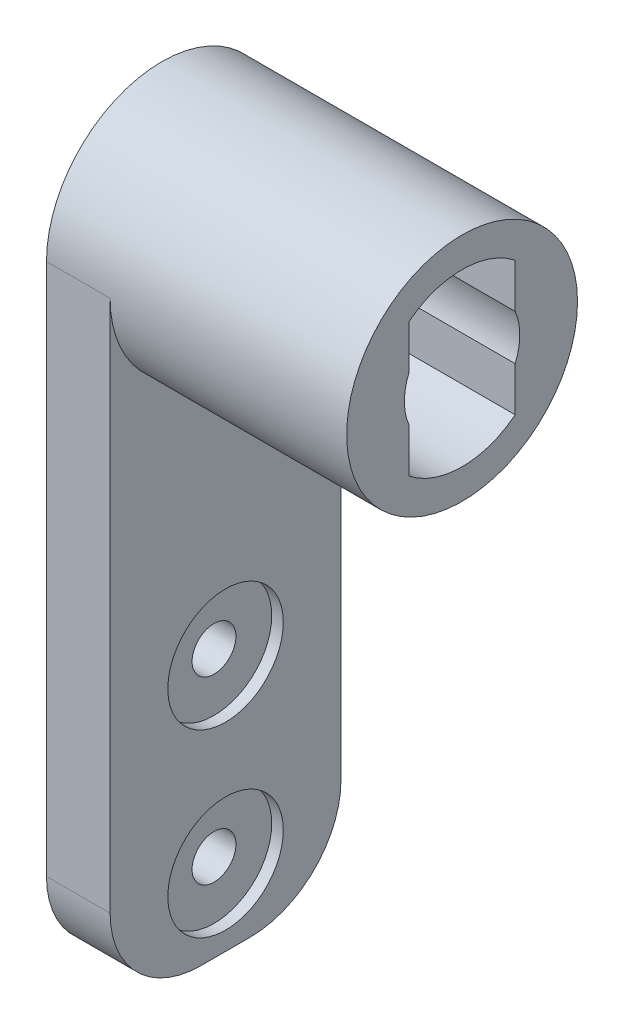
from build123d import *

# Parameters (mm, degrees)
SKETCH1_R           = 6.35
SKETCH1_R_2         = 3.175
BOSS_EXTRUDE1_DEPTH = 16.51
BOSS_EXTRUDE3_DEPTH = 3.5
FILLET2_R           = 5
SKETCH11_R          = 1.2065
CUT_EXTRUDE1_DEPTH  = 39.583762129
SKETCH12_R          = 3.175
CUT_EXTRUDE2_DEPTH  = 0.635
CUT_EXTRUDE3_DEPTH  = 10.16


with BuildPart() as part:
    # Sketch1 → Boss-Extrude1 (new body)
    with BuildSketch(Plane.YZ):
        Circle(SKETCH1_R)
        Circle(SKETCH1_R_2, mode=Mode.SUBTRACT)
    extrude(amount=BOSS_EXTRUDE1_DEPTH)

    # Sketch10 → Boss-Extrude3 (add)
    with BuildSketch(Plane(origin=(0, 0, 0), x_dir=(0, -1, 0), z_dir=(-1, 0, 0))):
        with BuildLine():
            Line((34.29, 6.35), (0, 6.35))
            ThreePointArc((0, 6.35), (6.35, 0), (0, -6.35))
            Line((0, -6.35), (34.29, -6.35))
            Line((34.29, -6.35), (34.29, 6.35))
        make_face()
    extrude(amount=-BOSS_EXTRUDE3_DEPTH)

    # Fillet2
    fillet2_edges = [part.edges().sort_by_distance(p)[0] for p in [
        (1.75, -34.29, 6.35),
        (1.75, -34.29, -6.35),
    ]]
    fillet(fillet2_edges, radius=FILLET2_R)

    # Sketch11 → Cut-Extrude1 (cut, through all)
    with BuildSketch(Plane(origin=(0, 0, 0), x_dir=(0, -1, 0), z_dir=(-1, 0, 0))):
        with Locations((30.099, 0)):
            Circle(SKETCH11_R)
        with Locations((20.193, 0)):
            Circle(SKETCH11_R)
    extrude(amount=-CUT_EXTRUDE1_DEPTH, mode=Mode.SUBTRACT)

    # Sketch12 → Cut-Extrude2 (cut)
    with BuildSketch(Plane.YZ.offset(3.5)):
        with Locations((-20.193, 0)):
            Circle(SKETCH12_R)
        with Locations((-30.099, 0)):
            Circle(SKETCH12_R)
    extrude(amount=-CUT_EXTRUDE2_DEPTH, mode=Mode.SUBTRACT)

    # Sketch13 → Cut-Extrude3 (cut)
    with BuildSketch(Plane.YZ.offset(16.51)):
        with BuildLine():
            ThreePointArc((-3.680809694, 2.921), (-4.699, 0), (-3.680809694, -2.921))
            Line((-3.680809694, -2.921), (3.680809694, -2.921))
            ThreePointArc((3.680809694, -2.921), (4.699, 0), (3.680809694, 2.921))
            Line((3.680809694, 2.921), (-3.680809694, 2.921))
        make_face()
    extrude(amount=-CUT_EXTRUDE3_DEPTH, mode=Mode.SUBTRACT)


solid = part.part
